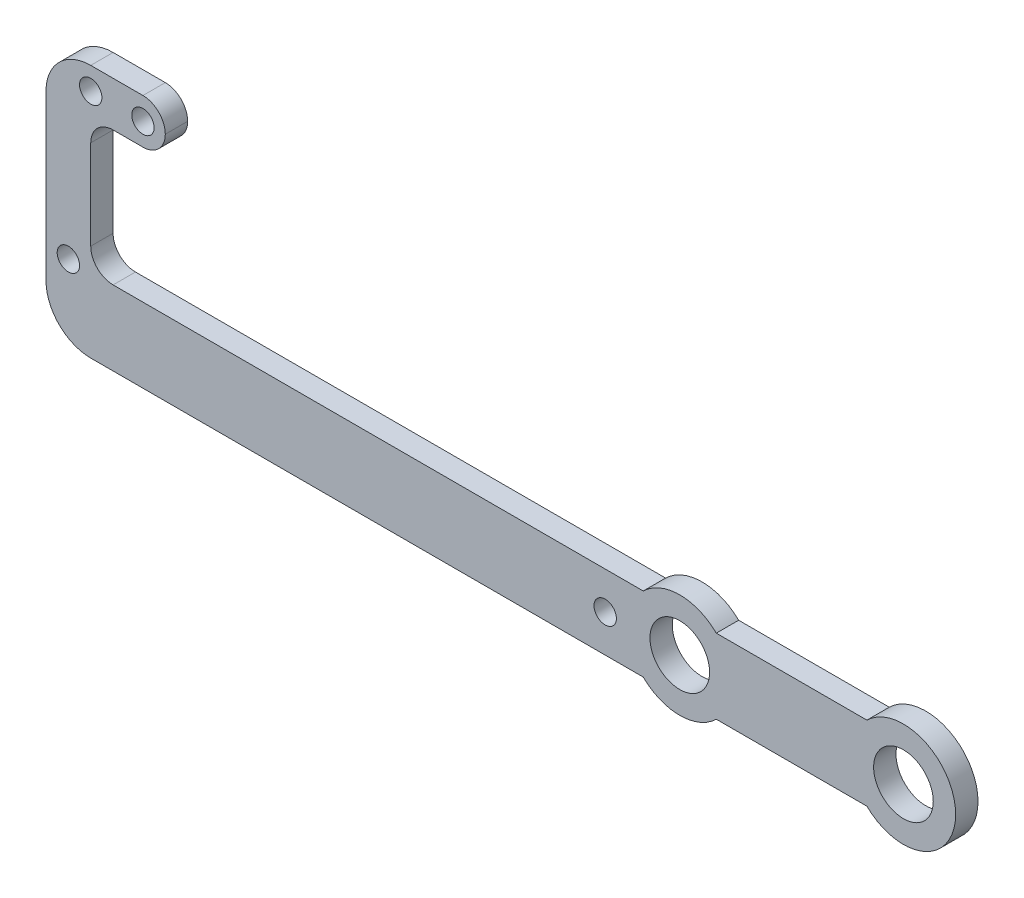
from build123d import *

# Parameters (mm, degrees)
EXTRUDE_1_DEPTH     = 3
CUT_EXTRUDE_START   = -4
SKETCH_3_R          = 4
CUT_EXTRUDE_1_DEPTH = 131.684647847
FILLET_START        = -1
FILLET_1_DEPTH      = 5
FILLET_1_2_DEPTH    = 3
FILLET_2_R          = 6
SKETCH_4_R          = 4
CUT_EXTRUDE_2_DEPTH = 4
SKETCH_5_R          = 1.5
CUT_EXTRUDE_4_DEPTH = 10


with BuildPart() as part:
    # 草图1 → 凸台-拉伸1 (new body)
    with BuildSketch(Plane.XY):
        with BuildLine():
            Line((0, 0), (80.101020514, 0))
            ThreePointArc((80.101020514, 0), (85, -2), (89.898979486, 0))
            Line((89.898979486, 0), (110.101020514, 0))
            ThreePointArc((110.101020514, 0), (122, 5), (110.101020514, 10))
            Line((110.101020514, 10), (89.898979486, 10))
            ThreePointArc((89.898979486, 10), (85, 12), (80.101020514, 10))
            Line((80.101020514, 10), (6, 10))
            Line((6, 10), (6, 28))
            Line((6, 28), (16, 28))
            Line((16, 28), (16, 34))
            Line((16, 34), (0, 34))
            Line((0, 34), (0, 0))
        make_face()
    extrude(amount=EXTRUDE_1_DEPTH)

    # 草图3 → 切除-拉伸1 (cut, through all)
    with BuildSketch(Plane.XY.offset(3).offset(CUT_EXTRUDE_START)):
        with Locations((115, 5)):
            Circle(SKETCH_3_R)
    extrude(amount=CUT_EXTRUDE_1_DEPTH, mode=Mode.SUBTRACT)

    # 圆角1: read off the stored shape, not the designer's step
    # 圆角1 outline → 圆角1 (cut)
    with BuildSketch(Plane.XY.offset(FILLET_START)):
        with BuildLine():
            ThreePointArc((13, 34), (15.121320344, 33.121320344), (16, 31))
            Line((16, 31), (16, 34))
            Line((16, 34), (13, 34))
        make_face()
        with BuildLine():
            ThreePointArc((16, 31), (15.121320344, 28.878679656), (13, 28))
            Line((13, 28), (16, 28))
            Line((16, 28), (16, 31))
        make_face()
    extrude(amount=FILLET_1_DEPTH, mode=Mode.SUBTRACT)

    # Fillet 1 2 outline → Fillet 1 2 (add)
    with BuildSketch(Plane.XY):
        with BuildLine():
            Line((6, 28), (6, 25))
            ThreePointArc((6, 25), (6.878679656, 27.121320344), (9, 28))
            Line((9, 28), (6, 28))
        make_face()
        with BuildLine():
            ThreePointArc((9, 10), (6.878679656, 10.878679656), (6, 13))
            Line((6, 13), (6, 10))
            Line((6, 10), (9, 10))
        make_face()
    extrude(amount=FILLET_1_2_DEPTH)

    # 圆角2
    fillet_2_edges = [part.edges().sort_by_distance(p)[0] for p in [
        (0, 34, 1.5),
        (0, 0, 1.5),
    ]]
    fillet(fillet_2_edges, radius=FILLET_2_R)

    # 草图4 → 切除-拉伸2 (cut)
    with BuildSketch(Plane.XY.offset(3)):
        with Locations((85, 5)):
            Circle(SKETCH_4_R)
    extrude(amount=-CUT_EXTRUDE_2_DEPTH, mode=Mode.SUBTRACT)

    # 草图5 → 切除-拉伸4 (cut)
    with BuildSketch(Plane.XY):
        with Locations((75, 5)):
            Circle(SKETCH_5_R)
        with Locations((3, 10)):
            Circle(SKETCH_5_R)
        with Locations((13, 31)):
            Circle(SKETCH_5_R)
        with Locations((6, 31)):
            Circle(SKETCH_5_R)
    extrude(amount=CUT_EXTRUDE_4_DEPTH, mode=Mode.SUBTRACT)


solid = part.part
